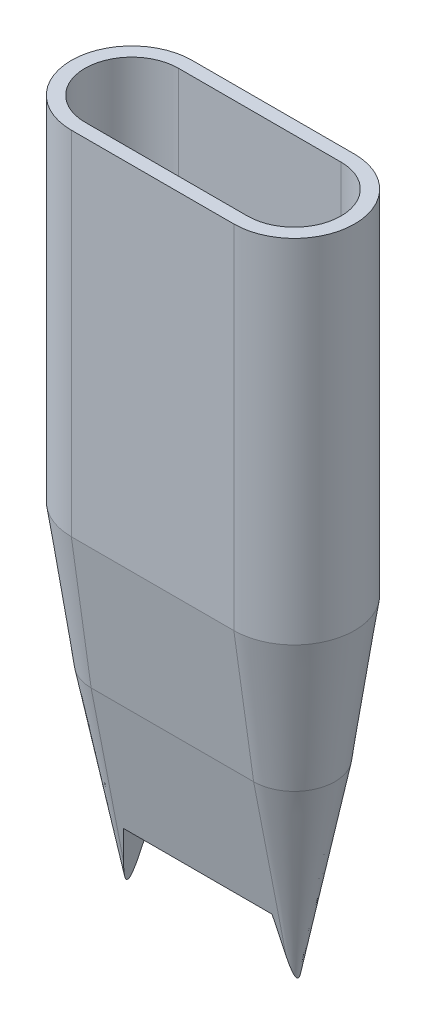
from build123d import *

# Parameters (mm, degrees)
BOSS_EXTRUDE1_DEPTH           = 18
BOSS_EXTRUDE1_TAPER           = 11
BOSS_EXTRUDE1_OTHER_WAY_DEPTH = 26
BOSS_EXTRUDE1_OTHER_WAY_TAPER = -8
SHELL1_START                  = -15
SHELL1_DEPTH                  = 30
SKETCH2_W                     = 25
SKETCH2_H                     = 3.2
BOSS_EXTRUDE2_DEPTH           = 20
BOSS_EXTRUDE2_TAPER           = 11
BOSS_EXTRUDE3_DEPTH           = 65


with BuildPart() as part:
    # Sketch1 → Boss-Extrude1 (new body)
    with BuildSketch(Plane(origin=(0, 0, 0), x_dir=(1, 0, 0), z_dir=(0, 1, 0))):
        with BuildLine():
            ThreePointArc((-15, 7.5), (-22.5, 0), (-15, -7.5))
            Line((-15, -7.5), (15, -7.5))
            ThreePointArc((15, -7.5), (22.5, 0), (15, 7.5))
            Line((15, 7.5), (-15, 7.5))
        make_face()
    extrude(amount=-BOSS_EXTRUDE1_DEPTH, taper=BOSS_EXTRUDE1_TAPER)

    # Sketch1 → Boss-Extrude1 other way (add)
    with BuildSketch(Plane(origin=(0, 0, 0), x_dir=(1, 0, 0), z_dir=(0, 1, 0))):
        with BuildLine():
            ThreePointArc((-15, 7.5), (-22.5, 0), (-15, -7.5))
            Line((-15, -7.5), (15, -7.5))
            ThreePointArc((15, -7.5), (22.5, 0), (15, 7.5))
            Line((15, 7.5), (-15, 7.5))
        make_face()
    extrude(amount=BOSS_EXTRUDE1_OTHER_WAY_DEPTH, taper=BOSS_EXTRUDE1_OTHER_WAY_TAPER)

    # Shell1: read off the stored shape, not the designer's step
    # Shell1 outline → Shell1 (cut)
    with BuildSketch(Plane.YZ.offset(SHELL1_START)):
        Polygon((26, -8.629492771), (26, 8.629492771), (0.412760457, 5.033440768), (-18, 1.454362698), (-18, -1.454362698), (0.412760457, -5.033440768), align=None)
    extrude(amount=SHELL1_DEPTH, mode=Mode.SUBTRACT)

    # Shell1 2 outline → Shell1 2 (revolve, cut)
    with BuildSketch(Plane(origin=(-15, 0, 0), x_dir=(1, 0, 0), z_dir=(0, 0, 1))):
        Polygon((1.454362698, -18), (5.033440768, 0.412760457), (8.629492771, 26), (0, 26), (0, -18), align=None)
    revolve(axis=Axis((-15, 0, 0), (0, 1, 0)), mode=Mode.SUBTRACT)

    # Shell1 3 outline → Shell1 3 (revolve, cut)
    with BuildSketch(Plane(origin=(15, 0, 0), x_dir=(1, 0, 0), z_dir=(0, 0, 1))):
        Polygon((1.454362698, -18), (5.033440768, 0.412760457), (8.629492771, 26), (0, 26), (0, -18), align=None)
    revolve(axis=Axis((15, 0, 0), (0, 1, 0)), mode=Mode.SUBTRACT)

    # Sketch2 → Boss-Extrude2 (add)
    with BuildSketch(Plane.XZ.offset(18)):
        with BuildLine():
            ThreePointArc((-15, 4.001154436), (-19.001154436, 0), (-15, -4.001154436))
            Line((-15, -4.001154436), (15, -4.001154436))
            ThreePointArc((15, -4.001154436), (19.001154436, 0), (15, 4.001154436))
            Line((15, 4.001154436), (-15, 4.001154436))
        make_face()
        Rectangle(SKETCH2_W, SKETCH2_H, mode=Mode.SUBTRACT)
    extrude(amount=BOSS_EXTRUDE2_DEPTH, taper=BOSS_EXTRUDE2_TAPER)

    # Sketch3 → Boss-Extrude3 (add)
    with BuildSketch(Plane(origin=(0, 26, 0), x_dir=(1, 0, 0), z_dir=(0, 1, 0))):
        with BuildLine():
            Line((-15, -11.154061702), (15, -11.154061702))
            ThreePointArc((15, -11.154061702), (26.154061702, 0), (15, 11.154061702))
            Line((15, 11.154061702), (-15, 11.154061702))
            ThreePointArc((-15, 11.154061702), (-26.154061702, 0), (-15, -11.154061702))
        make_face()
        with BuildLine():
            Line((-15, -8.629492771), (15, -8.629492771))
            ThreePointArc((15, -8.629492771), (23.629492771, 0), (15, 8.629492771))
            Line((15, 8.629492771), (-15, 8.629492771))
            ThreePointArc((-15, 8.629492771), (-23.629492771, 0), (-15, -8.629492771))
        make_face(mode=Mode.SUBTRACT)
    extrude(amount=BOSS_EXTRUDE3_DEPTH)


solid = part.part
